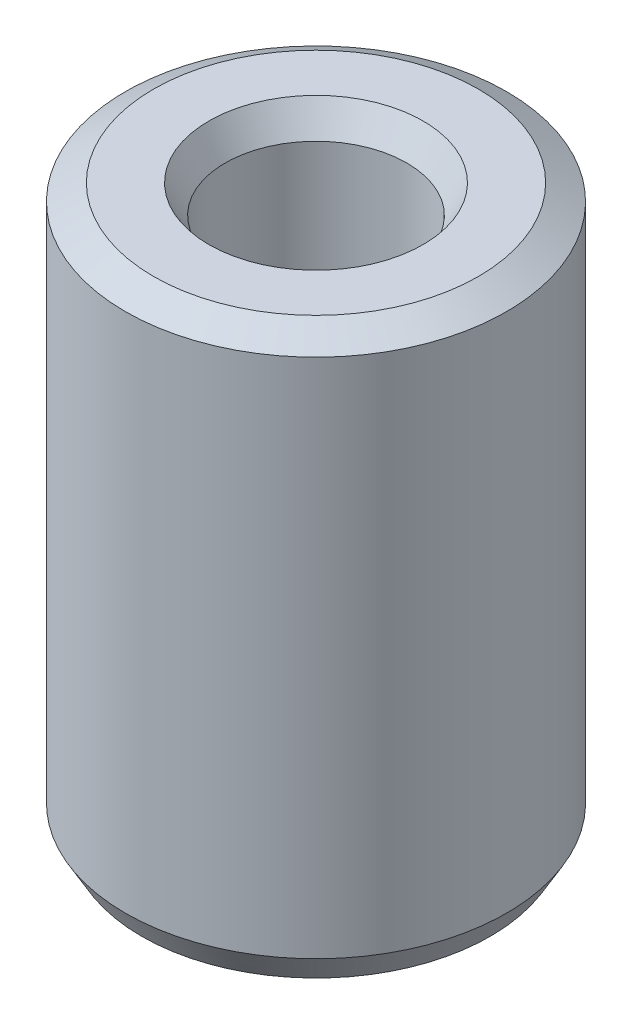
from build123d import *
from OCP.BRepFilletAPI import BRepFilletAPI_MakeChamfer

# Parameters (mm, degrees)
SKETCH1_R           = 5
BOSS_EXTRUDE1_DEPTH = 14.833691602
SKETCH2_R           = 2.382424655
CUT_EXTRUDE1_DEPTH  = 17.432845358
CHAMFER1_SIZE       = 0.427476805
CHAMFER1_SIZE2      = 0.740411546


with BuildPart() as part:
    # Sketch1 → Boss-Extrude1 (new body)
    with BuildSketch(Plane(origin=(0, 0, 0), x_dir=(1, 0, 0), z_dir=(0, 1, 0))):
        Circle(SKETCH1_R)
    extrude(amount=BOSS_EXTRUDE1_DEPTH)

    # Sketch2 → Cut-Extrude1 (cut, through all)
    with BuildSketch(Plane(origin=(0, 0, 0), x_dir=(1, 0, 0), z_dir=(0, 1, 0))):
        Circle(SKETCH2_R)
    extrude(amount=CUT_EXTRUDE1_DEPTH, mode=Mode.SUBTRACT)

    # Chamfer1: one chamfer whose edges measure the first distance from different faces: ONE call of the kernel's chamfer builder (chamfer() names one face for all edges)
    chamfer1_edges_1 = [part.edges().sort_by_distance(p)[0] for p in [
        (-2.382424655, 14.833691602, 0),
    ]]
    chamfer1_side_1 = [part.faces().sort_by_distance(p)[0] for p in [
        (-4.858578644, 14.833691602, 0),
    ]]
    chamfer1_edges_2 = [part.edges().sort_by_distance(p)[0] for p in [
        (-2.382424655, 0, 0),
    ]]
    chamfer1_side_2 = [part.faces().sort_by_distance(p)[0] for p in [
        (-2.382424655, 7.416845801, 0),
    ]]
    chamfer1_edges_3 = [part.edges().sort_by_distance(p)[0] for p in [
        (-5, 0, 0),
    ]]
    chamfer1_side_3 = [part.faces().sort_by_distance(p)[0] for p in [
        (-4.858578644, 0, 0),
    ]]
    chamfer1_edges_4 = [part.edges().sort_by_distance(p)[0] for p in [
        (-5, 14.833691602, 0),
    ]]
    chamfer1_side_4 = [part.faces().sort_by_distance(p)[0] for p in [
        (-5, 7.416845801, 0),
    ]]
    chamfer1 = BRepFilletAPI_MakeChamfer(part.part.solid().wrapped)
    for e in chamfer1_edges_1:
        chamfer1.Add(CHAMFER1_SIZE, CHAMFER1_SIZE2, e.wrapped, chamfer1_side_1[0].wrapped)  # the first distance lies on this face
    for e in chamfer1_edges_2:
        chamfer1.Add(CHAMFER1_SIZE, CHAMFER1_SIZE2, e.wrapped, chamfer1_side_2[0].wrapped)  # the first distance lies on this face
    for e in chamfer1_edges_3:
        chamfer1.Add(CHAMFER1_SIZE, CHAMFER1_SIZE2, e.wrapped, chamfer1_side_3[0].wrapped)  # the first distance lies on this face
    for e in chamfer1_edges_4:
        chamfer1.Add(CHAMFER1_SIZE, CHAMFER1_SIZE2, e.wrapped, chamfer1_side_4[0].wrapped)  # the first distance lies on this face
    add(Compound.cast(chamfer1.Shape()), mode=Mode.REPLACE)


solid = part.part
